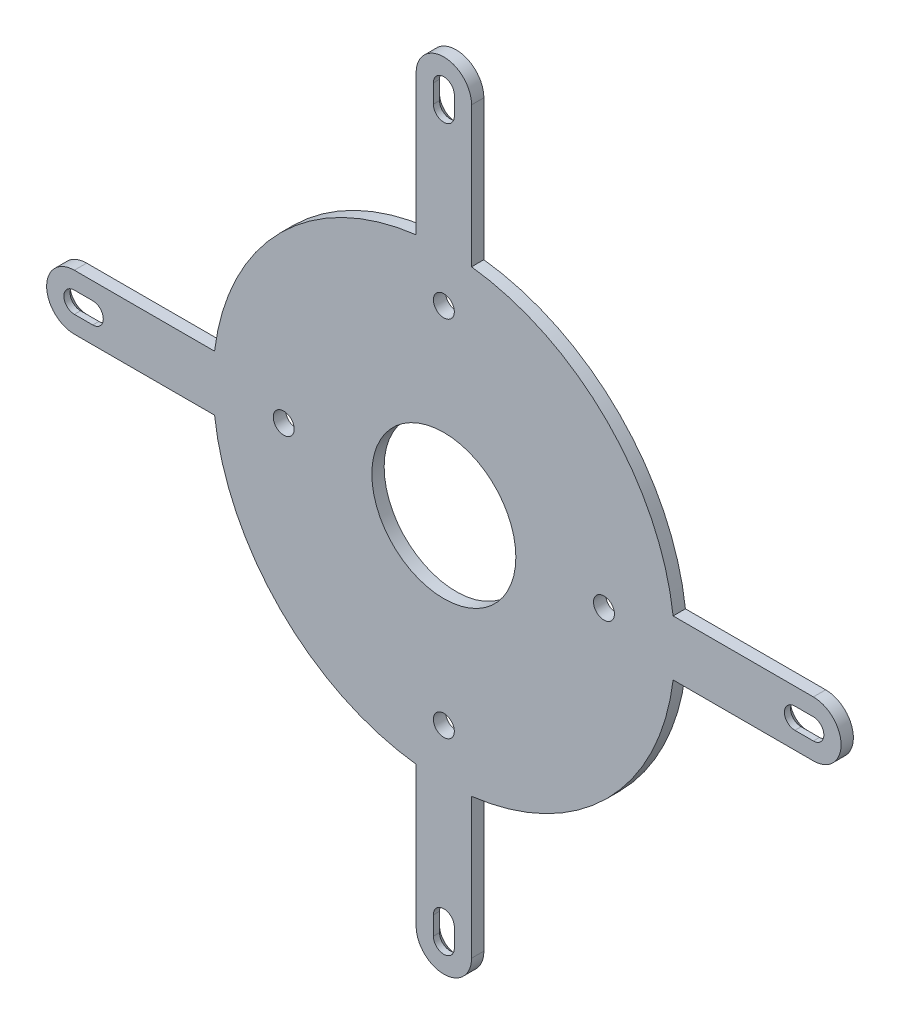
from build123d import *

# Parameters (mm, degrees)
BOSS_EXTRUDE1_DEPTH = 2
SKETCH1_3_R         = 1.7
CUT_EXTRUDE1_DEPTH  = 13
CHAMFER1_SIZE       = 1
SKETCH2_R           = 11.692051929
CUT_EXTRUDE2_DEPTH  = 10


with BuildPart() as part:
    # Sketch1 → Boss-Extrude1 (new body)
    with BuildSketch(Plane.XY):
        with BuildLine():
            Line((37.229020938, -4.5), (60, -4.5))
            ThreePointArc((60, -4.5), (64.5, 0), (60, 4.5))
            Line((60, 4.5), (37.229020938, 4.5))
            ThreePointArc((37.229020938, 4.5), (26.516504294, 26.516504294), (4.5, 37.229020938))
            Line((4.5, 37.229020938), (4.5, 60))
            ThreePointArc((4.5, 60), (0, 64.5), (-4.5, 60))
            Line((-4.5, 60), (-4.5, 37.229020938))
            ThreePointArc((-4.5, 37.229020938), (-26.516504294, 26.516504294), (-37.229020938, 4.5))
            Line((-37.229020938, 4.5), (-60, 4.5))
            ThreePointArc((-60, 4.5), (-64.5, 0), (-60, -4.5))
            Line((-60, -4.5), (-37.229020938, -4.5))
            ThreePointArc((-37.229020938, -4.5), (-26.516504294, -26.516504294), (-4.5, -37.229020938))
            Line((-4.5, -37.229020938), (-4.5, -60))
            ThreePointArc((-4.5, -60), (0, -64.5), (4.5, -60))
            Line((4.5, -60), (4.5, -37.229020938))
            ThreePointArc((4.5, -37.229020938), (26.516504294, -26.516504294), (37.229020938, -4.5))
        make_face()
        with BuildLine():
            ThreePointArc((60, 1.7), (61.7, 0), (60, -1.7))
            Line((60, -1.7), (57, -1.7))
            ThreePointArc((57, -1.7), (55.3, 0), (57, 1.7))
            Line((57, 1.7), (60, 1.7))
        make_face(mode=Mode.SUBTRACT)
        with BuildLine():
            Line((-1.7, -60), (-1.7, -57))
            ThreePointArc((-1.7, -57), (0, -55.3), (1.7, -57))
            Line((1.7, -57), (1.7, -60))
            ThreePointArc((1.7, -60), (0, -61.7), (-1.7, -60))
        make_face(mode=Mode.SUBTRACT)
        with BuildLine():
            Line((-60, 1.7), (-57, 1.7))
            ThreePointArc((-57, 1.7), (-55.3, 0), (-57, -1.7))
            Line((-57, -1.7), (-60, -1.7))
            ThreePointArc((-60, -1.7), (-61.7, 0), (-60, 1.7))
        make_face(mode=Mode.SUBTRACT)
        with BuildLine():
            Line((1.7, 60), (1.7, 57))
            ThreePointArc((1.7, 57), (0, 55.3), (-1.7, 57))
            Line((-1.7, 57), (-1.7, 60))
            ThreePointArc((-1.7, 60), (0, 61.7), (1.7, 60))
        make_face(mode=Mode.SUBTRACT)
    extrude(amount=BOSS_EXTRUDE1_DEPTH)

    # Sketch1<3> → Cut-Extrude1 (cut)
    with BuildSketch(Plane.XY):
        with Locations((0, 29.5)):
            Circle(SKETCH1_3_R)
        with Locations((26, 0)):
            Circle(SKETCH1_3_R)
        with Locations((-26, 0)):
            Circle(SKETCH1_3_R)
        with Locations((0, -29.5)):
            Circle(SKETCH1_3_R)
    extrude(amount=CUT_EXTRUDE1_DEPTH, mode=Mode.SUBTRACT)

    # Chamfer1
    chamfer1_edges = [part.edges().sort_by_distance(p)[0] for p in [
        (0, 55.3, 0),
        (1.7, 58.5, 0),
        (-1.7, 58.5, 0),
        (0, 61.7, 0),
        (-58.5, -1.7, 0),
        (-61.7, 0, 0),
        (-55.3, 0, 0),
        (-58.5, 1.7, 0),
        (0, -61.7, 0),
        (1.7, -58.5, 0),
        (-1.7, -58.5, 0),
        (0, -55.3, 0),
        (58.5, -1.7, 0),
        (61.7, 0, 0),
        (55.3, 0, 0),
        (58.5, 1.7, 0),
    ]]
    chamfer(chamfer1_edges, length=CHAMFER1_SIZE)

    # Sketch2 → Cut-Extrude2 (cut)
    with BuildSketch(Plane(origin=(0, 0, 0), x_dir=(-1, 0, 0), z_dir=(0, 0, -1))):
        Circle(SKETCH2_R)
    extrude(amount=-CUT_EXTRUDE2_DEPTH, mode=Mode.SUBTRACT)


solid = part.part
